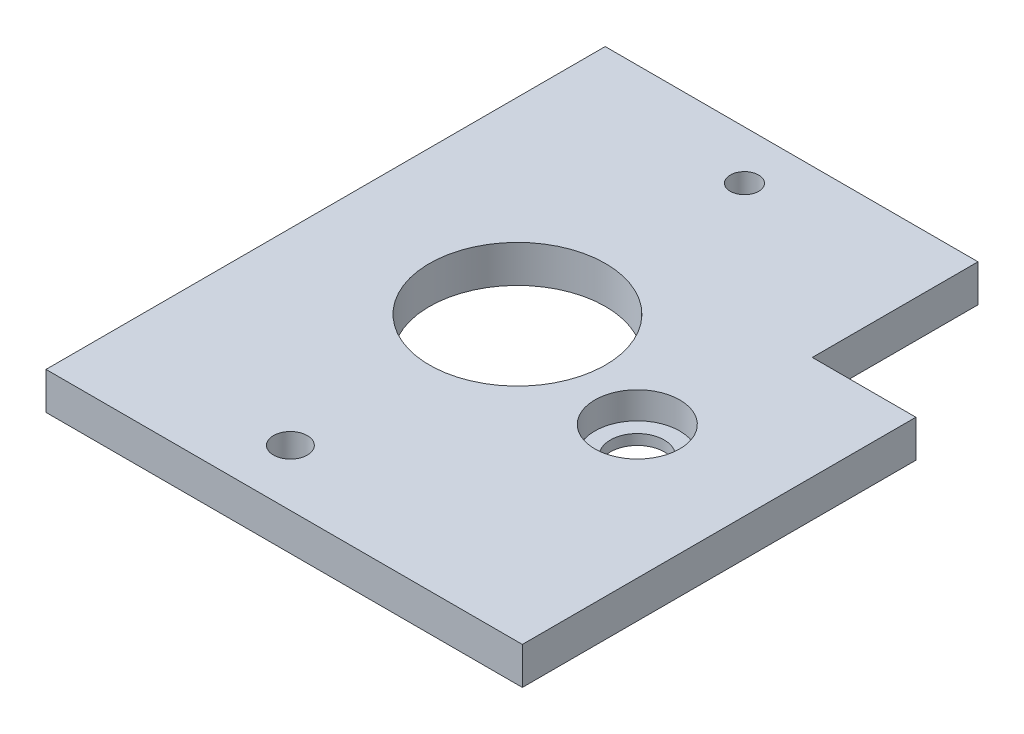
from build123d import *

# Parameters (mm, degrees)
SKETCH_1_W          = 46
SKETCH_1_H          = 54
EXTRUDE_1_DEPTH     = 3.6
SKETCH_2_R          = 1.368482886
SKETCH_2_R_2        = 1.634420344
SKETCH_2_R_3        = 8.5
SKETCH_2_R_4        = 4.1
CUT_EXTRUDE_1_DEPTH = 3.6
SKETCH_4_R          = 4.1
SKETCH_4_R_2        = 2.6
EXTRUDE_2_DEPTH     = 1
SKETCH_5_W          = 10
SKETCH_5_H          = 16
CUT_EXTRUDE_2_DEPTH = 4


with BuildPart() as part:
    # 草图1 → 凸台-拉伸1 (new body)
    with BuildSketch(Plane(origin=(0, 0, 0), x_dir=(1, 0, 0), z_dir=(0, 1, 0))):
        with Locations((23, 27)):
            Rectangle(SKETCH_1_W, SKETCH_1_H)
    extrude(amount=EXTRUDE_1_DEPTH)

    # 草图2 → 切除-拉伸1 (cut)
    with BuildSketch(Plane(origin=(0, 0, 0), x_dir=(-1, 0, 0), z_dir=(0, -1, 0))):
        with Locations((-18.15, 49.3)):
            Circle(SKETCH_2_R)
        with Locations((-18.15, 5.45)):
            Circle(SKETCH_2_R_2)
        with Locations((-18.15, 27.375)):
            Circle(SKETCH_2_R_3)
        with Locations((-33.15, 23.95)):
            Circle(SKETCH_2_R_4)
    extrude(amount=-CUT_EXTRUDE_1_DEPTH, mode=Mode.SUBTRACT)

    # 草图4 → 凸台-拉伸2 (add)
    with BuildSketch(Plane(origin=(0, 0, 0), x_dir=(-1, 0, 0), z_dir=(0, -1, 0))):
        with Locations((-33.15, 23.95)):
            Circle(SKETCH_4_R)
        with Locations((-33.15, 23.95)):
            Circle(SKETCH_4_R_2, mode=Mode.SUBTRACT)
    extrude(amount=-EXTRUDE_2_DEPTH)

    # 草图5 → 切除-拉伸2 (cut)
    with BuildSketch(Plane(origin=(0, 3.6, 0), x_dir=(1, 0, 0), z_dir=(0, 1, 0))):
        with Locations((41, 46)):
            Rectangle(SKETCH_5_W, SKETCH_5_H)
    extrude(amount=-CUT_EXTRUDE_2_DEPTH, mode=Mode.SUBTRACT)


solid = part.part
